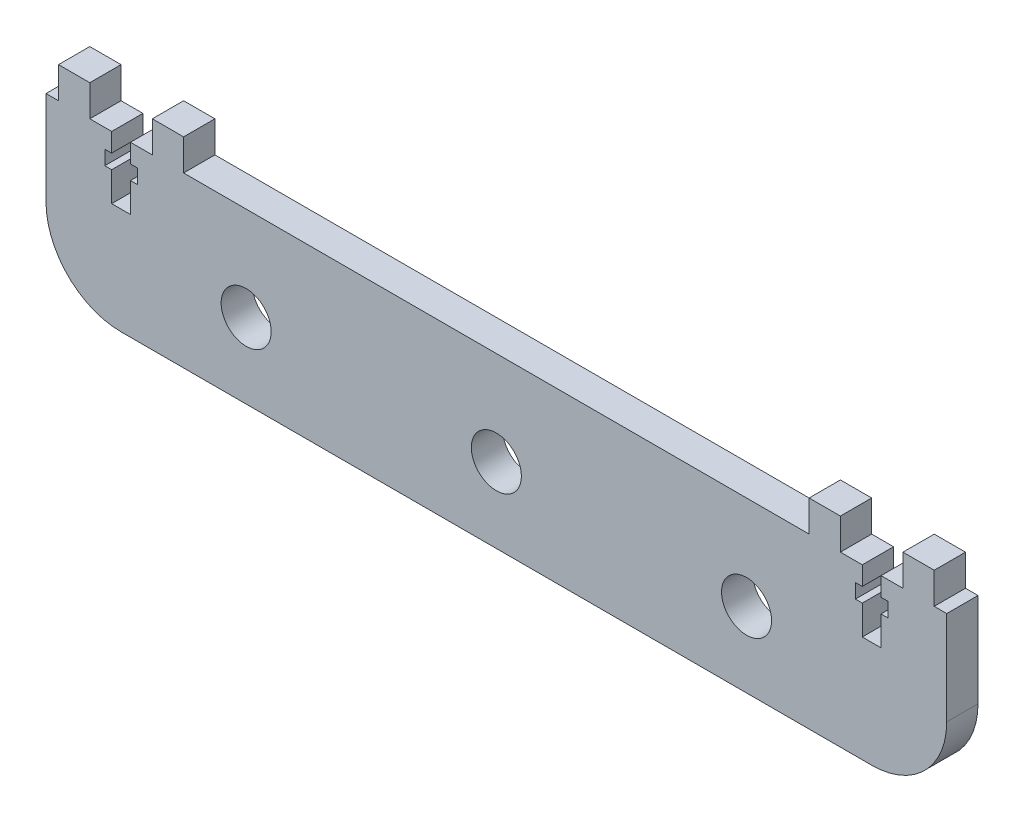
from build123d import *

# Parameters (mm, degrees)
SKETCH1_R           = 4
BOSS_EXTRUDE2_DEPTH = 5


with BuildPart() as part:
    # Sketch1 → Boss-Extrude2 (new body)
    with BuildSketch(Plane.XY):
        with BuildLine():
            Line((-72, 15), (-72, 0))
            ThreePointArc((-72, 0), (-68.485281374, -8.485281374), (-60, -12))
            Line((-60, -12), (60, -12))
            ThreePointArc((60, -12), (68.485281374, -8.485281374), (72, 0))
            Line((72, 0), (72, 15))
            Line((72, 15), (70, 15))
            Line((70, 15), (70, 20))
            Line((70, 20), (65, 20))
            Line((65, 20), (65, 15))
            Line((65, 15), (61.5, 15))
            Line((61.5, 15), (61.5, 12))
            Line((61.5, 12), (62.6, 12))
            Line((62.6, 12), (62.6, 9.7))
            Line((62.6, 9.7), (61.5, 9.7))
            Line((61.5, 9.7), (61.5, 5))
            Line((61.5, 5), (58.5, 5))
            Line((58.5, 5), (58.5, 9.7))
            Line((58.5, 9.7), (57.4, 9.7))
            Line((57.4, 9.7), (57.4, 12))
            Line((57.4, 12), (58.5, 12))
            Line((58.5, 12), (58.5, 15))
            Line((58.5, 15), (55, 15))
            Line((55, 15), (55, 20))
            Line((55, 20), (50, 20))
            Line((50, 20), (50, 15))
            Line((50, 15), (-50, 15))
            Line((-50, 15), (-50, 20))
            Line((-50, 20), (-55, 20))
            Line((-55, 20), (-55, 15))
            Line((-55, 15), (-58.5, 15))
            Line((-58.5, 15), (-58.5, 12))
            Line((-58.5, 12), (-57.4, 12))
            Line((-57.4, 12), (-57.4, 9.7))
            Line((-57.4, 9.7), (-58.5, 9.7))
            Line((-58.5, 9.7), (-58.5, 5))
            Line((-58.5, 5), (-61.5, 5))
            Line((-61.5, 5), (-61.5, 9.7))
            Line((-61.5, 9.7), (-62.6, 9.7))
            Line((-62.6, 9.7), (-62.6, 12))
            Line((-62.6, 12), (-61.5, 12))
            Line((-61.5, 12), (-61.5, 15))
            Line((-61.5, 15), (-65, 15))
            Line((-65, 15), (-65, 20))
            Line((-65, 20), (-70, 20))
            Line((-70, 20), (-70, 15))
            Line((-70, 15), (-72, 15))
        make_face()
        with Locations((-40, 0)):
            Circle(SKETCH1_R, mode=Mode.SUBTRACT)
        Circle(SKETCH1_R, mode=Mode.SUBTRACT)
        with Locations((40, 0)):
            Circle(SKETCH1_R, mode=Mode.SUBTRACT)
    extrude(amount=BOSS_EXTRUDE2_DEPTH)


solid = part.part
